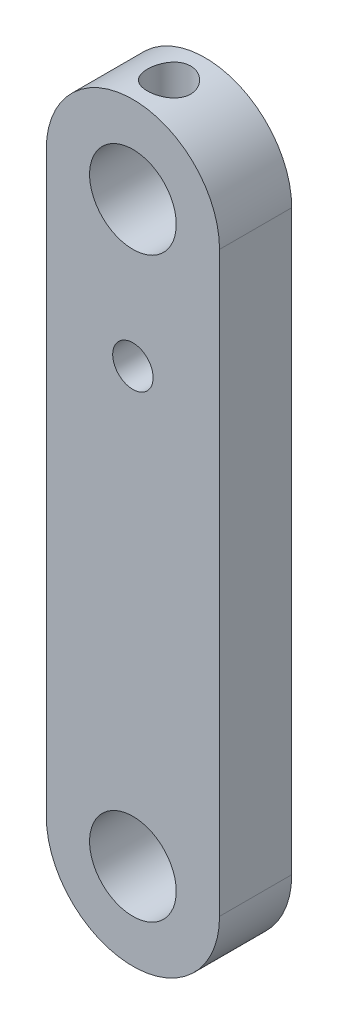
from build123d import *

# Parameters (mm, degrees)
DODANIE_WYCI_GNI_CIE1_DEPTH = 5
WYTNIJ_WYCI_GNI_CIE1_REACH  = 54.583
SZKIC4_R                    = 1.5


with BuildPart() as part:
    # Szkic1 → Dodanie-wyciągnięcie1 (new body)
    with BuildSketch(Plane.XY):
        with BuildLine():
            ThreePointArc((-6, -40), (0, -46), (6, -40))
            Line((6, -40), (6, 0))
            ThreePointArc((6, 0), (0, 6), (-6, 0))
            Line((-6, 0), (-6, -40))
        make_face()
        with BuildLine():
            ThreePointArc((3, -40), (-2.121320344, -42.121320344), (0, -37))
            ThreePointArc((0, -37), (2.121320344, -37.878679656), (3, -40))
        make_face(mode=Mode.SUBTRACT)
        with BuildLine():
            ThreePointArc((3, 0), (2.121320344, -2.121320344), (0, -3))
            ThreePointArc((0, -3), (-2.121320344, 2.121320344), (3, 0))
        make_face(mode=Mode.SUBTRACT)
        with BuildLine():
            ThreePointArc((0, -11.4), (-1.4, -10), (0, -8.6))
            ThreePointArc((0, -8.6), (0.989949494, -9.010050506), (1.4, -10))
            ThreePointArc((1.4, -10), (0.989949494, -10.989949494), (0, -11.4))
        make_face(mode=Mode.SUBTRACT)
    extrude(amount=DODANIE_WYCI_GNI_CIE1_DEPTH)

    # Szkic4 → Wytnij-wyciągnięcie1 (cut, up to next)
    with BuildSketch(Plane(origin=(0, 6, 0), x_dir=(1, 0, 0), z_dir=(0, 1, 0)), mode=Mode.PRIVATE) as wytnij_wyci_gni_cie1_sk1:
        with Locations((0, -2.5)):
            Circle(SZKIC4_R)
    wytnij_wyci_gni_cie1_tool1 = extrude(wytnij_wyci_gni_cie1_sk1.sketch, amount=-WYTNIJ_WYCI_GNI_CIE1_REACH, mode=Mode.PRIVATE) & part.part
    add(wytnij_wyci_gni_cie1_tool1.solids().sort_by_distance((0, 6, 2.5))[0], mode=Mode.SUBTRACT)


solid = part.part
